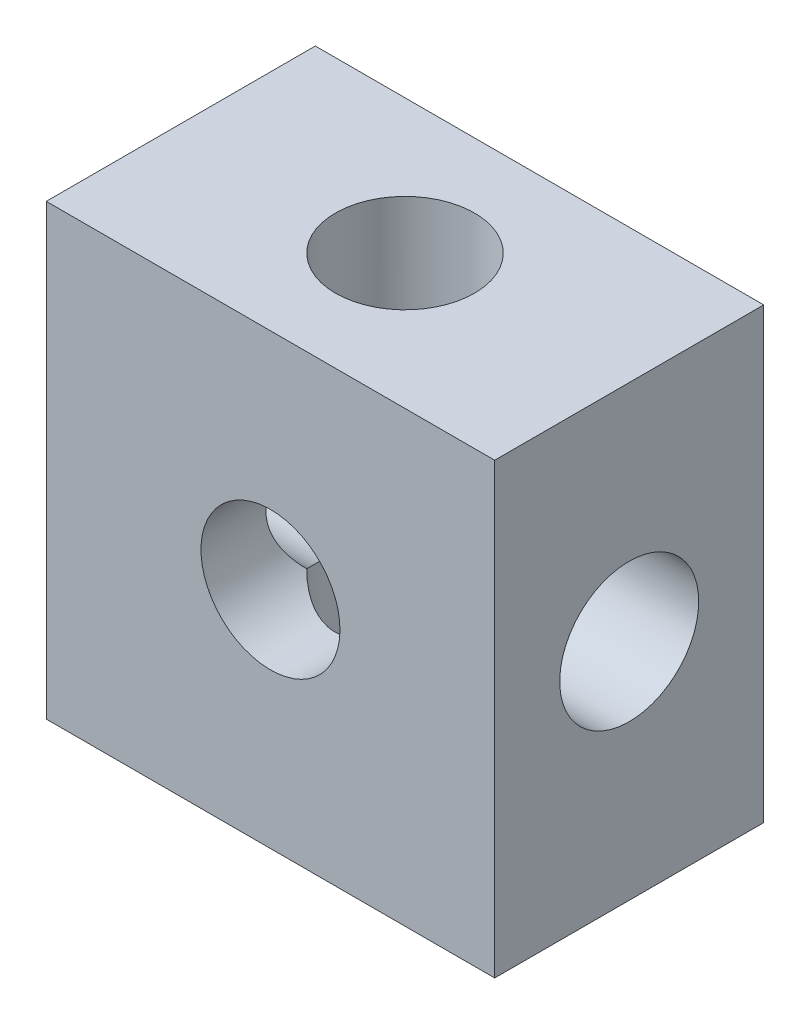
from build123d import *

# Parameters (mm, degrees)
SKETCH_1_W          = 10
SKETCH_1_H          = 6
EXTRUDE_1_DEPTH     = 10
SKETCH_2_R          = 1.55
CUT_EXTRUDE_1_DEPTH = 10
SKETCH_3_R          = 1.55
CUT_EXTRUDE_2_DEPTH = 10
SKETCH_4_R          = 1.55
CUT_EXTRUDE_3_DEPTH = 10


with BuildPart() as part:
    # 草图1 → 凸台-拉伸1 (new body)
    with BuildSketch(Plane(origin=(0, 0, 0), x_dir=(1, 0, 0), z_dir=(0, 1, 0))):
        with Locations((5, 3)):
            Rectangle(SKETCH_1_W, SKETCH_1_H)
    extrude(amount=EXTRUDE_1_DEPTH)

    # 草图2 → 切除-拉伸1 (cut)
    with BuildSketch(Plane(origin=(0, 10, 0), x_dir=(1, 0, 0), z_dir=(0, 1, 0))):
        with Locations((5, 3)):
            Circle(SKETCH_2_R)
    extrude(amount=-CUT_EXTRUDE_1_DEPTH, mode=Mode.SUBTRACT)

    # 草图3 → 切除-拉伸2 (cut)
    with BuildSketch(Plane.XY):
        with Locations((5, 5)):
            Circle(SKETCH_3_R)
    extrude(amount=-CUT_EXTRUDE_2_DEPTH, mode=Mode.SUBTRACT)

    # 草图4 → 切除-拉伸3 (cut)
    with BuildSketch(Plane(origin=(10, 0, 0), x_dir=(0, 0, -1), z_dir=(1, 0, 0))):
        with Locations((3, 5)):
            Circle(SKETCH_4_R)
    extrude(amount=-CUT_EXTRUDE_3_DEPTH, mode=Mode.SUBTRACT)


solid = part.part
